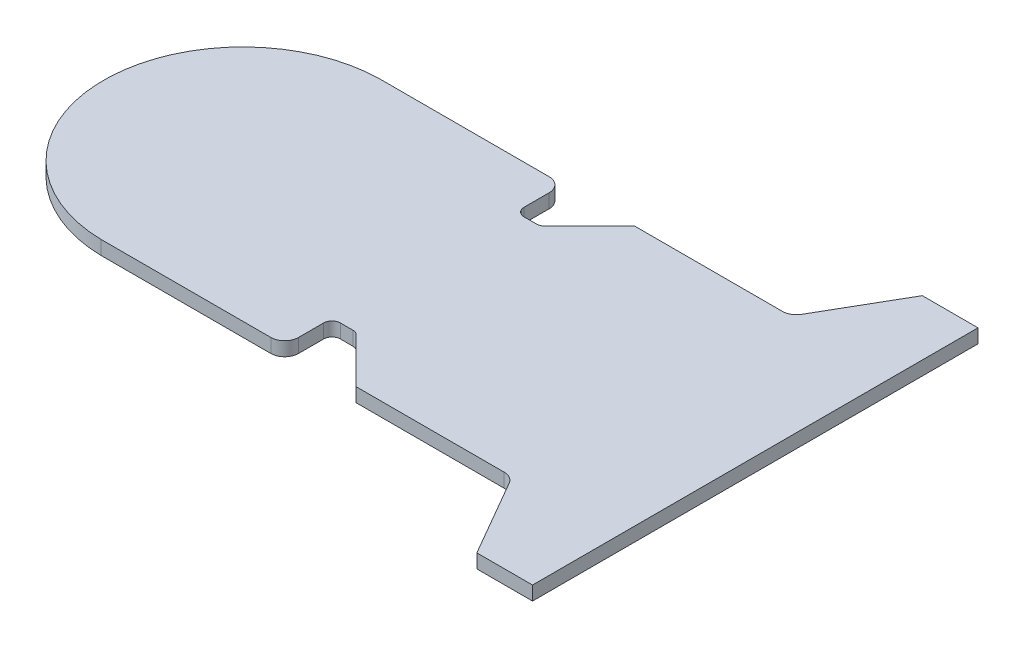
from build123d import *

# Parameters (mm, degrees)
BOSS_EXTRUDE1_DEPTH = 5


with BuildPart() as part:
    # Sketch1 → Boss-Extrude1 (new body)
    with BuildSketch(Plane(origin=(0, 0, 0), x_dir=(1, 0, 0), z_dir=(0, 1, 0))):
        with BuildLine():
            Line((15.254575611, 35.990242765), (15.254575611, 44.990242765))
            ThreePointArc((15.254575611, 44.990242765), (13.790109517, 48.525776671), (10.254575611, 49.990242765))
            Line((10.254575611, 49.990242765), (-50.745424389, 49.990242765))
            ThreePointArc((-50.745424389, 49.990242765), (-99.757685432, 0), (-50.745424389, -49.990242765))
            Line((-50.745424389, -49.990242765), (10.254575611, -49.990242765))
            ThreePointArc((10.254575611, -49.990242765), (13.790109517, -48.525776671), (15.254575611, -44.990242765))
            Line((15.254575611, -44.990242765), (15.254575611, -35.990242765))
            ThreePointArc((15.254575611, -35.990242765), (16.133255268, -33.868922422), (18.254575611, -32.990242765))
            Line((18.254575611, -32.990242765), (22.711934924, -32.990242765))
            ThreePointArc((22.711934924, -32.990242765), (23.859985221, -33.218604168), (24.833255268, -33.868922422))
            Line((24.833255268, -33.868922422), (40.954575611, -49.990242765))
            Line((40.954575611, -49.990242765), (50.745424389, -49.990242765))
            Line((50.745424389, -49.990242765), (94.067824265, -49.990242765))
            ThreePointArc((94.067824265, -49.990242765), (96.567824265, -50.660115747), (98.397951284, -52.490242765))
            Line((98.397951284, -52.490242765), (114.280717029, -80))
            Line((114.280717029, -80), (134.280717029, -80))
            Line((134.280717029, -80), (134.280717029, 80))
            Line((134.280717029, 80), (114.280717029, 80))
            Line((114.280717029, 80), (98.397951284, 52.490242765))
            ThreePointArc((98.397951284, 52.490242765), (96.567824265, 50.660115747), (94.067824265, 49.990242765))
            Line((94.067824265, 49.990242765), (50.745424389, 49.990242765))
            Line((50.745424389, 49.990242765), (40.954575611, 49.990242765))
            Line((40.954575611, 49.990242765), (24.833255268, 33.868922422))
            ThreePointArc((24.833255268, 33.868922422), (23.859985221, 33.218604168), (22.711934924, 32.990242765))
            Line((22.711934924, 32.990242765), (18.254575611, 32.990242765))
            ThreePointArc((18.254575611, 32.990242765), (16.133255268, 33.868922422), (15.254575611, 35.990242765))
        make_face()
    extrude(amount=BOSS_EXTRUDE1_DEPTH)


solid = part.part
